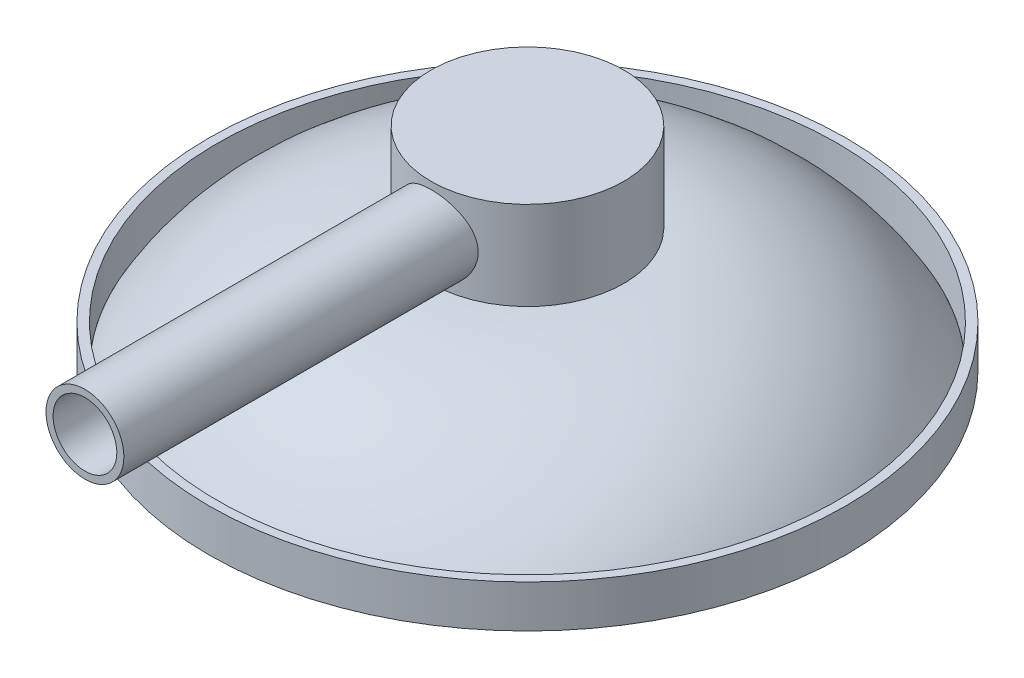
from build123d import *

# Parameters (mm, degrees)
SKETCH1_R           = 22.225
BOSS_EXTRUDE2_DEPTH = 8.89
FILLET1_R           = 17.62
SKETCH4_R           = 22.86
SKETCH4_R_2         = 22.225
BOSS_EXTRUDE4_DEPTH = 3.048
SKETCH6_R           = 6.919723132
BOSS_EXTRUDE5_DEPTH = 6.35
SKETCH7_R           = 2.794
BOSS_EXTRUDE6_DEPTH = 31.75
SHELL1_START        = 0.508
SHELL1_OUTLINE_R    = 6.411723132
SHELL1_DEPTH        = 14.224
SHELL1_START_2      = 5.990358975
SHELL1_2_OUTLINE_R  = 2.286
SHELL1_2_DEPTH      = 25.759641025


with BuildPart() as part:
    # Sketch1 → Boss-Extrude2 (new body)
    with BuildSketch(Plane(origin=(0, 0, 0), x_dir=(1, 0, 0), z_dir=(0, 1, 0))):
        with Locations(Location((0, 0, 0), (0, 0, 270))):
            Circle(SKETCH1_R)
    extrude(amount=BOSS_EXTRUDE2_DEPTH)

    # Fillet1
    # the kernel refuses this fillet: 17.62 mm, written as the material it takes off along each edge
    with BuildSketch(Plane(origin=(0, 8.89, 0), x_dir=(0, 0, 1), z_dir=(-1, 0, 0))) as fillet1_piece_1:
        with BuildLine():
            CenterArc((6.919723132, -17.62), FILLET1_R, 29.700068365, 60.299931635)
            Line((6.919723132, 0), (6.919723132, 0.3524))
            Line((6.919723132, 0.3524), (22.225, 0.3524))
            Line((22.225, 0.3524), (22.5774, 0))
            ThreePointArc((22.5774, 0), (22.5774, -4.445), (22.531105537, -8.7154))
            Line((22.531105537, -8.7154), (22.225, -8.89))
        make_face()
    revolve(axis=Axis((0, 8.89, 0), (0, 1, 0)), mode=Mode.SUBTRACT)

    # Sketch6 → Boss-Extrude5 (add)
    with BuildSketch(Plane(origin=(0, 8.89, 0), x_dir=(1, 0, 0), z_dir=(0, 1, 0))):
        with Locations(Location((0, 0, 0), (0, 0, 270))):
            Circle(SKETCH6_R)
    extrude(amount=BOSS_EXTRUDE5_DEPTH)

    # Sketch7 → Boss-Extrude6 (add)
    with BuildSketch(Plane.XY):
        with Locations(Location((0, 11.938, 0), (0, 0, 180))):
            Circle(SKETCH7_R)
    extrude(amount=BOSS_EXTRUDE6_DEPTH)

    # Shell1: read off the stored shape, not the designer's step
    # Shell1 outline → Shell1 (cut)
    with BuildSketch(Plane(origin=(0, 0, 0), x_dir=(1, 0, 0), z_dir=(0, 1, 0)).offset(SHELL1_START)):
        Circle(SHELL1_OUTLINE_R)
    extrude(amount=SHELL1_DEPTH, mode=Mode.SUBTRACT)

    # Shell1 2 outline → Shell1 2 (cut)
    with BuildSketch(Plane.XY.offset(SHELL1_START_2)):
        with Locations((0, 11.938)):
            Circle(SHELL1_2_OUTLINE_R)
    extrude(amount=SHELL1_2_DEPTH, mode=Mode.SUBTRACT)

    # Shell1 3 outline → Shell1 3 (revolve, cut)
    with BuildSketch(Plane.XY):
        with BuildLine():
            Line((6.411723132, 8.374457898), (6.411723132, 0.508))
            Line((6.411723132, 0.508), (21.323885725, 0.508))
            ThreePointArc((21.323885725, 0.508), (14.903840095, 6.405204668), (6.411723132, 8.374457898))
        make_face()
    revolve(axis=Axis((0, 0, 0), (0, 1, 0)), mode=Mode.SUBTRACT)


with BuildPart() as body_2:
    # Sketch4 → Boss-Extrude4 (new body)
    with BuildSketch(Plane(origin=(0, 0, 0), x_dir=(-1, 0, 0), z_dir=(0, -1, 0))):
        with Locations(Location((0, 0, 0), (0, 0, 90))):
            Circle(SKETCH4_R)
        with Locations(Location((0, 0, 0), (0, 0, 90))):
            Circle(SKETCH4_R_2, mode=Mode.SUBTRACT)
    extrude(amount=-BOSS_EXTRUDE4_DEPTH)


solid = Compound([part.part, body_2.part])
